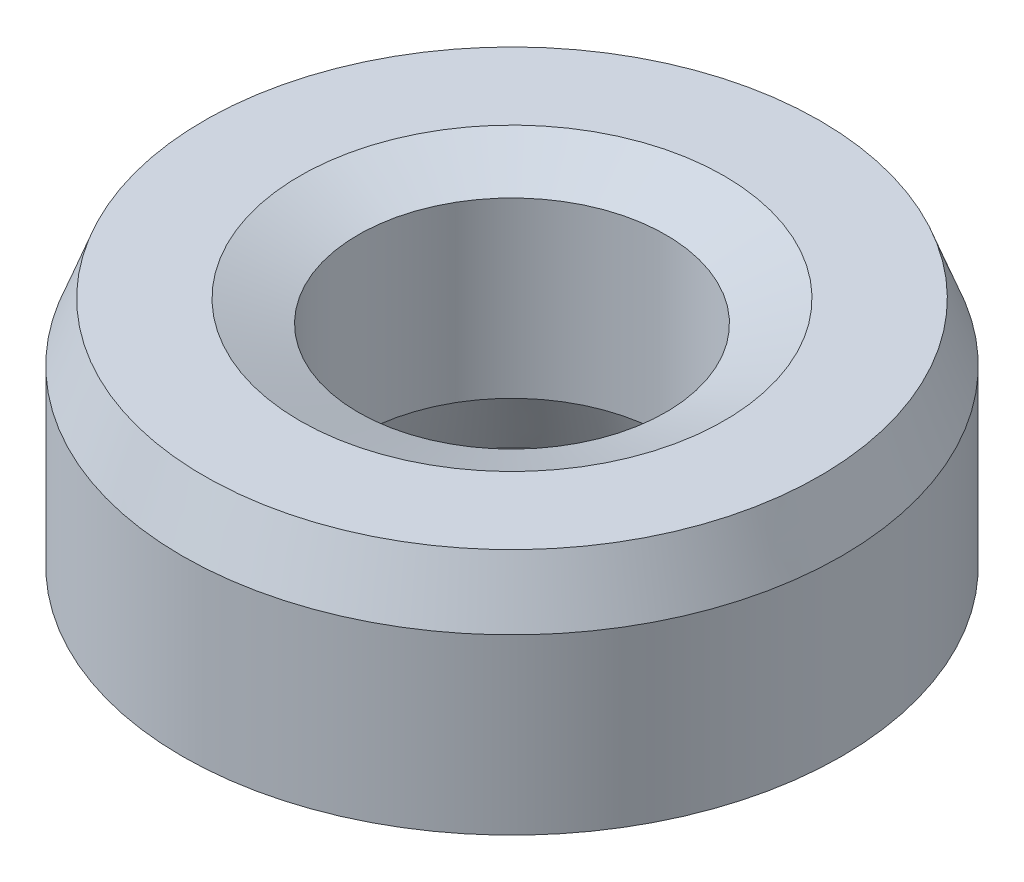
from build123d import *
from OCP.BRepFilletAPI import BRepFilletAPI_MakeChamfer

# Parameters (mm, degrees)
SKETCH1_R           = 10
BOSS_EXTRUDE1_DEPTH = 7.694185593
SKETCH2_R           = 4.664843002
CUT_EXTRUDE1_DEPTH  = 17.099704716
CHAMFER1_SIZE       = 1.769672046
CHAMFER1_SIZE2      = 0.662846741


with BuildPart() as part:
    # Sketch1 → Boss-Extrude1 (new body)
    with BuildSketch(Plane(origin=(0, 0, 0), x_dir=(1, 0, 0), z_dir=(0, 1, 0))):
        Circle(SKETCH1_R)
    extrude(amount=BOSS_EXTRUDE1_DEPTH)

    # Sketch2 → Cut-Extrude1 (cut, through all)
    with BuildSketch(Plane(origin=(0, 0, 0), x_dir=(1, 0, 0), z_dir=(0, 1, 0))):
        Circle(SKETCH2_R)
    extrude(amount=CUT_EXTRUDE1_DEPTH, mode=Mode.SUBTRACT)

    # Chamfer1: one chamfer whose edges measure the first distance from different faces: ONE call of the kernel's chamfer builder (chamfer() names one face for all edges)
    chamfer1_edges_1 = [part.edges().sort_by_distance(p)[0] for p in [
        (-4.664843002, 7.694185593, 0),
    ]]
    chamfer1_side_1 = [part.faces().sort_by_distance(p)[0] for p in [
        (-9.717157288, 7.694185593, 0),
    ]]
    chamfer1_edges_2 = [part.edges().sort_by_distance(p)[0] for p in [
        (-4.664843002, 0, 0),
    ]]
    chamfer1_side_2 = [part.faces().sort_by_distance(p)[0] for p in [
        (-4.664843002, 3.847092796, 0),
    ]]
    chamfer1_edges_3 = [part.edges().sort_by_distance(p)[0] for p in [
        (-10, 0, 0),
    ]]
    chamfer1_side_3 = [part.faces().sort_by_distance(p)[0] for p in [
        (-9.717157288, 0, 0),
    ]]
    chamfer1_edges_4 = [part.edges().sort_by_distance(p)[0] for p in [
        (-10, 7.694185593, 0),
    ]]
    chamfer1_side_4 = [part.faces().sort_by_distance(p)[0] for p in [
        (-10, 3.847092796, 0),
    ]]
    chamfer1 = BRepFilletAPI_MakeChamfer(part.part.solid().wrapped)
    for e in chamfer1_edges_1:
        chamfer1.Add(CHAMFER1_SIZE, CHAMFER1_SIZE2, e.wrapped, chamfer1_side_1[0].wrapped)  # the first distance lies on this face
    for e in chamfer1_edges_2:
        chamfer1.Add(CHAMFER1_SIZE, CHAMFER1_SIZE2, e.wrapped, chamfer1_side_2[0].wrapped)  # the first distance lies on this face
    for e in chamfer1_edges_3:
        chamfer1.Add(CHAMFER1_SIZE, CHAMFER1_SIZE2, e.wrapped, chamfer1_side_3[0].wrapped)  # the first distance lies on this face
    for e in chamfer1_edges_4:
        chamfer1.Add(CHAMFER1_SIZE, CHAMFER1_SIZE2, e.wrapped, chamfer1_side_4[0].wrapped)  # the first distance lies on this face
    add(Compound.cast(chamfer1.Shape()), mode=Mode.REPLACE)


solid = part.part
